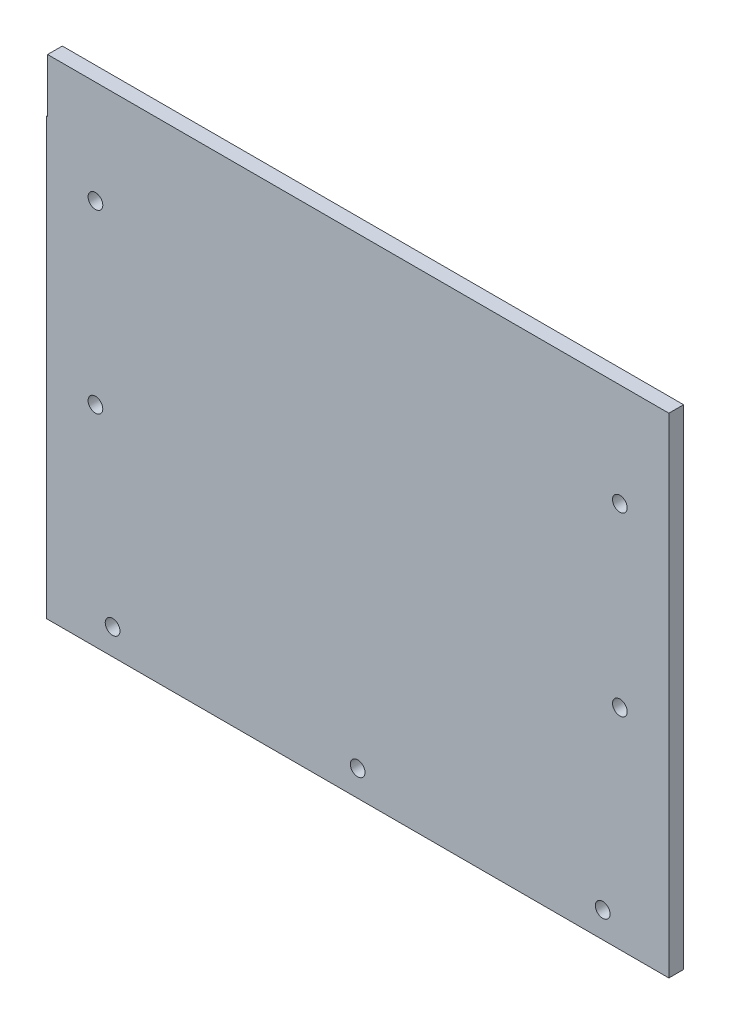
from build123d import *

# Parameters (mm, degrees)
SKETCH_1_W          = 127
SKETCH_1_H          = 92
EXTRUDE_1_DEPTH     = 3
SKETCH_2_R          = 1.5
CUT_EXTRUDE_1_DEPTH = 79.468146403
SKETCH_3_R          = 1.5
CUT_EXTRUDE_2_DEPTH = 79.468146403
SKETCH_4_W          = 127
SKETCH_4_H          = 3.2
CUT_EXTRUDE_3_DEPTH = 10
SKETCH_5_W          = 126.758917164
SKETCH_5_H          = 11
EXTRUDE_2_DEPTH     = 3


with BuildPart() as part:
    # 草图1 → 凸台-拉伸1 (new body)
    with BuildSketch(Plane.XY):
        Rectangle(SKETCH_1_W, SKETCH_1_H)
    extrude(amount=EXTRUDE_1_DEPTH)

    # 草图2 → 切除-拉伸1 (cut, through all)
    with BuildSketch(Plane.XY.offset(3)):
        with Locations((0, -37.5)):
            Circle(SKETCH_2_R)
        with Locations((-50, -37.5)):
            Circle(SKETCH_2_R)
        with Locations((50, -37.5)):
            Circle(SKETCH_2_R)
    extrude(amount=-CUT_EXTRUDE_1_DEPTH, mode=Mode.SUBTRACT)

    # 草图3 → 切除-拉伸2 (cut, through all)
    with BuildSketch(Plane.XY.offset(3)):
        with Locations((-53.5, 36)):
            Circle(SKETCH_3_R)
        with Locations((53.5, 36)):
            Circle(SKETCH_3_R)
        with Locations((-53.5, 0)):
            Circle(SKETCH_3_R)
        with Locations((53.5, 0)):
            Circle(SKETCH_3_R)
    extrude(amount=-CUT_EXTRUDE_2_DEPTH, mode=Mode.SUBTRACT)

    # 草图4 → 切除-拉伸3 (cut)
    with BuildSketch(Plane(origin=(0, 0, 0), x_dir=(-1, 0, 0), z_dir=(0, 0, -1))):
        with Locations((0, -44.4)):
            Rectangle(SKETCH_4_W, SKETCH_4_H)
    extrude(amount=-CUT_EXTRUDE_3_DEPTH, mode=Mode.SUBTRACT)

    # 草图5 → 凸台-拉伸2 (add)
    with BuildSketch(Plane(origin=(0, 0, 0), x_dir=(-1, 0, 0), z_dir=(0, 0, -1))):
        with Locations((-0.120541418, 51.5)):
            Rectangle(SKETCH_5_W, SKETCH_5_H)
    extrude(amount=-EXTRUDE_2_DEPTH)


solid = part.part
